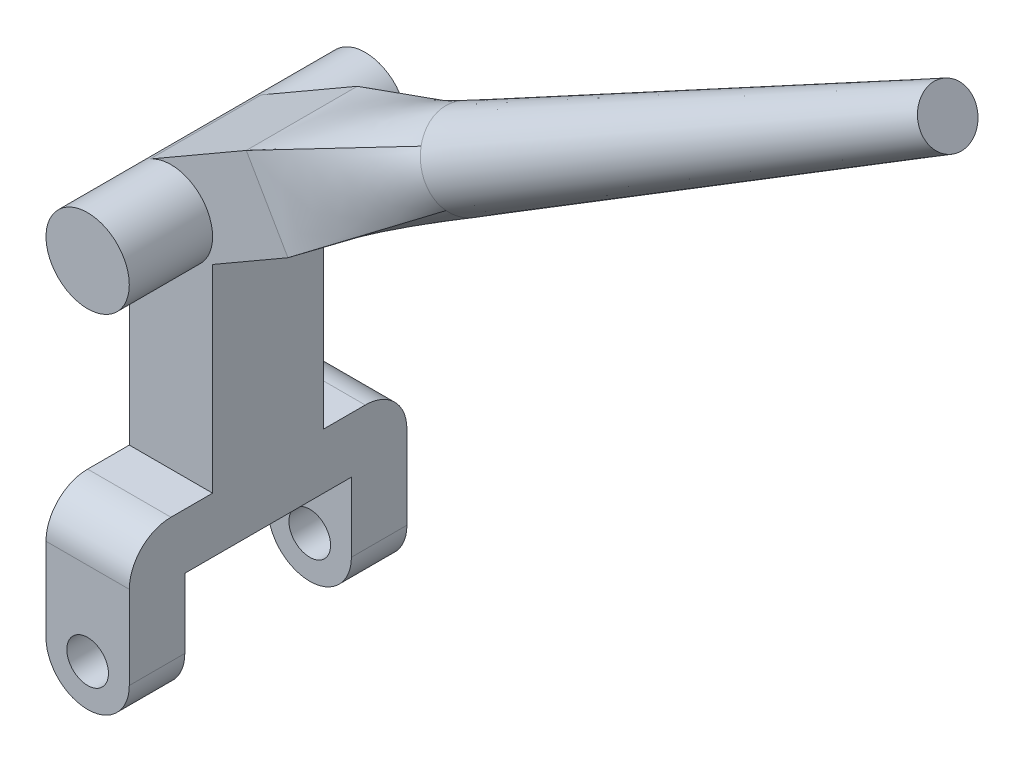
from build123d import *

# Parameters (mm, degrees)
SKETCH2_R           = 9.525
BOSS_EXTRUDE1_DEPTH = 63.5
SKETCH3_W           = 19.05
SKETCH3_H           = 25.4
BOSS_EXTRUDE2_DEPTH = 50.8
SKETCH4_W           = 25.4
SKETCH4_H           = 19.05
BOSS_EXTRUDE3_DEPTH = 25.4
SKETCH5_2_R         = 9.525
BOSS_EXTRUDE4_DEPTH = 127
BOSS_EXTRUDE4_TAPER = 1.5
SKETCH8_W           = 19.05
SKETCH8_H           = 63.5
BOSS_EXTRUDE5_DEPTH = 12.7
SKETCH9_W           = 19.05
SKETCH9_H           = 12.7
BOSS_EXTRUDE6_DEPTH = 25.4
FILLET2_R           = 9.525
SKETCH12_R          = 4.7625
CUT_EXTRUDE1_DEPTH  = 206.928278116
FILLET3_R           = 9.525


with BuildPart() as part:
    # Sketch2 → Boss-Extrude1 (new body)
    with BuildSketch(Plane.XY):
        Circle(SKETCH2_R)
    extrude(amount=BOSS_EXTRUDE1_DEPTH)

    # Sketch3 → Boss-Extrude2 (add)
    with BuildSketch(Plane(origin=(0, 0, 0), x_dir=(1, 0, 0), z_dir=(0, 1, 0))):
        with Locations((0, -31.75)):
            Rectangle(SKETCH3_W, SKETCH3_H)
    extrude(amount=-BOSS_EXTRUDE2_DEPTH)

    # Sketch4 → Boss-Extrude3 (add)
    with BuildSketch(Plane(origin=(0, 0, 0), x_dir=(0, 0, -1), z_dir=(0.8660254037844398, 0.499999999999998, 0))):
        with Locations((-31.75, 0)):
            Rectangle(SKETCH4_W, SKETCH4_H)
    extrude(amount=BOSS_EXTRUDE3_DEPTH)

    # Sketch6 → Loft1 section 0
    with BuildSketch(Plane(origin=(21.997045256, 12.7, 0), x_dir=(0, 0, -1), z_dir=(0.8660254037844397, 0.4999999999999981, 0))):
        with BuildLine():
            Line((-44.45, 9.525), (-44.45, -9.525))
            Line((-44.45, -9.525), (-19.05, -9.525))
            Line((-19.05, -9.525), (-19.05, 9.525))
            Line((-19.05, 9.525), (-44.45, 9.525))
        make_face()
    # Sketch5 for Loft1 → Loft1 section 1
    with BuildSketch(Plane(origin=(54.99261314, 31.75, 0), x_dir=(0, 0, -1), z_dir=(0.8660254037844397, 0.4999999999999981, 0))):
        with BuildLine():
            # circular arc as an exact rational Bezier (weights 1, cos(half-angle), 1)
            Bezier((-39.37, 5.715), (-43.65625, 0), (-39.37, -5.715), weights=[1, 0.8, 1])
            Bezier((-39.37, -5.715), (-31.75, -15.875), (-24.13, -5.715), weights=[1, 0.6, 1])
            Bezier((-24.13, -5.715), (-19.84375, 0), (-24.13, 5.715), weights=[1, 0.8, 1])
            Bezier((-24.13, 5.715), (-31.75, 15.875), (-39.37, 5.715), weights=[1, 0.6, 1])
        make_face()
    loft()

    # Sketch5<2> → Boss-Extrude4 (add)
    with BuildSketch(Plane(origin=(54.99261314, 31.75, 0), x_dir=(0, 0, -1), z_dir=(0.8660254037844397, 0.4999999999999981, 0))):
        with Locations((-31.75, 0)):
            Circle(SKETCH5_2_R)
    extrude(amount=BOSS_EXTRUDE4_DEPTH, taper=BOSS_EXTRUDE4_TAPER)

    # Sketch8 → Boss-Extrude5 (add)
    with BuildSketch(Plane.XZ.offset(50.8)):
        with Locations((0, 31.75)):
            Rectangle(SKETCH8_W, SKETCH8_H)
    extrude(amount=BOSS_EXTRUDE5_DEPTH)

    # Sketch9 → Boss-Extrude6 (add)
    with BuildSketch(Plane.XZ.offset(63.5)):
        with Locations((0, 57.15)):
            Rectangle(SKETCH9_W, SKETCH9_H)
        with Locations((0, 6.35)):
            Rectangle(SKETCH9_W, SKETCH9_H)
    extrude(amount=BOSS_EXTRUDE6_DEPTH)

    # Fillet2
    fillet2_edges = [part.edges().sort_by_distance(p)[0] for p in [
        (9.525, -88.9, 6.35),
        (9.525, -88.9, 57.15),
        (-9.525, -88.9, 57.15),
        (-9.525, -88.9, 6.35),
    ]]
    fillet(fillet2_edges, radius=FILLET2_R - 0.0001)  # a hair under: the kernel refuses the full size

    # Sketch12 → Cut-Extrude1 (cut, through all)
    with BuildSketch(Plane(origin=(0, 0, 0), x_dir=(-1, 0, 0), z_dir=(0, 0, -1))):
        with Locations((0, -79.375)):
            Circle(SKETCH12_R)
    extrude(amount=-CUT_EXTRUDE1_DEPTH, mode=Mode.SUBTRACT)

    # Fillet3
    fillet3_edges = [part.edges().sort_by_distance(p)[0] for p in [
        (0, -50.8, 0),
        (0, -50.8, 63.5),
    ]]
    fillet(fillet3_edges, radius=FILLET3_R)


solid = part.part
